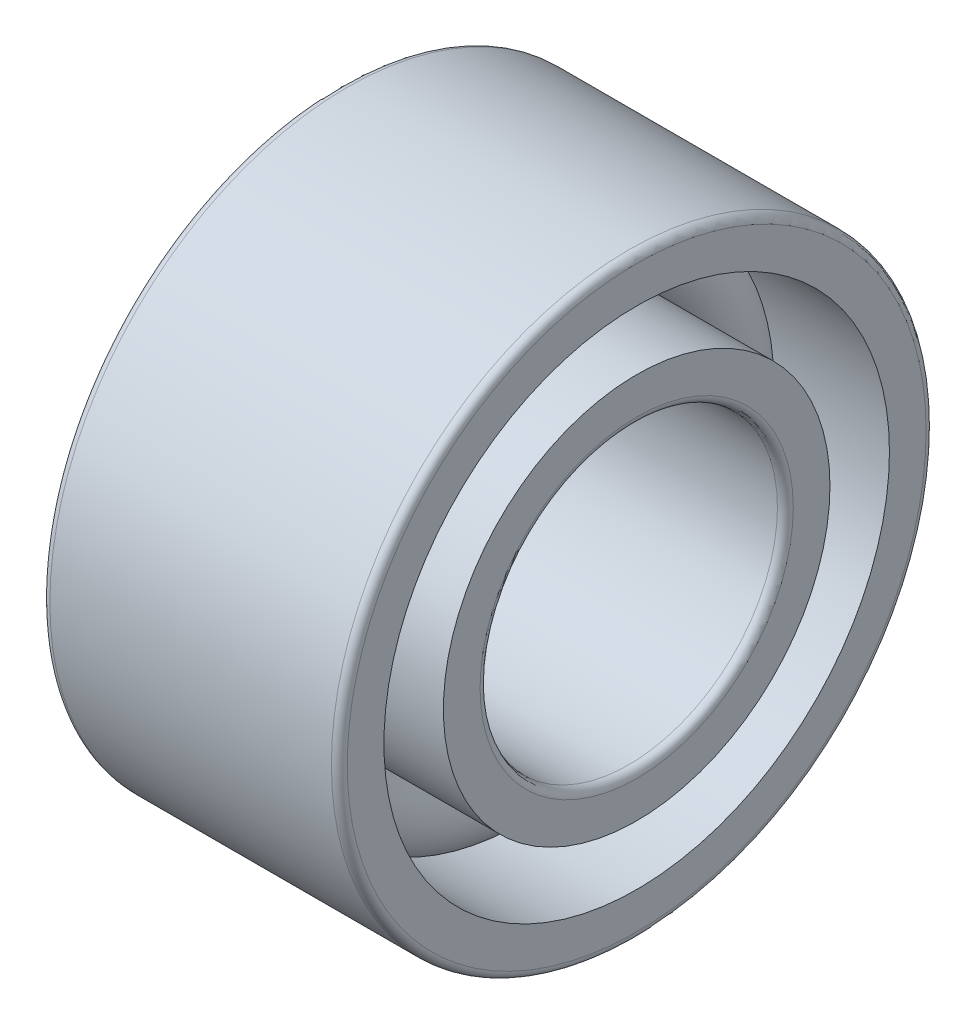
from build123d import *

# Parameters (mm, degrees)
CAGSPISKE_W     = 0.09
CAGSPISKE_H     = 0.15
CAGESPINE_ANGLE = 0.001
BALSIMSKE_R     = 0.45


with BuildPart() as part:
    # CagSpiSke → CageSpine (revolve)
    with BuildSketch(Plane.XY):
        with Locations((0, 2.25)):
            Rectangle(CAGSPISKE_W, CAGSPISKE_H)
    revolve(axis=Axis((-20.6375, 0, 0), (-1, 0, 0)), revolution_arc=CAGESPINE_ANGLE)

    # BalSimSke → BallsSimplified (revolve)
    with BuildSketch(Plane.XY):
        with Locations((0, 2.25)):
            Circle(BALSIMSKE_R)
    revolve(axis=Axis((-10, 0, 0), (1, 0, 0)))

    # InnRacSke → InnerRace (revolve)
    with BuildSketch(Plane.XY):
        with BuildLine():
            Line((-0.301039864, 1.95), (-1.5, 1.95))
            Line((-1.5, 1.95), (-1.5, 1.58))
            ThreePointArc((-1.5, 1.58), (-1.476568542, 1.523431458), (-1.42, 1.5))
            Line((-1.42, 1.5), (1.42, 1.5))
            ThreePointArc((1.42, 1.5), (1.476568542, 1.523431458), (1.5, 1.58))
            Line((1.5, 1.58), (1.5, 1.95))
            Line((1.5, 1.95), (0.301039864, 1.95))
            ThreePointArc((0.301039864, 1.95), (0, 1.825), (-0.301039864, 1.95))
        make_face()
    revolve(axis=Axis((-20.6375, 0, 0), (1, 0, 0)))

    # OutRacSke → OuterRace (revolve)
    with BuildSketch(Plane.XY):
        with BuildLine():
            Line((-0.301039864, 2.55), (-1.5, 2.55))
            Line((-1.5, 2.55), (-1.5, 2.92))
            ThreePointArc((-1.5, 2.92), (-1.476568542, 2.976568542), (-1.42, 3))
            Line((-1.42, 3), (1.42, 3))
            ThreePointArc((1.42, 3), (1.476568542, 2.976568542), (1.5, 2.92))
            Line((1.5, 2.92), (1.5, 2.55))
            Line((1.5, 2.55), (0.301039864, 2.55))
            ThreePointArc((0.301039864, 2.55), (0, 2.675), (-0.301039864, 2.55))
        make_face()
    revolve(axis=Axis((-20.6375, 0, 0), (1, 0, 0)))


solid = part.part
